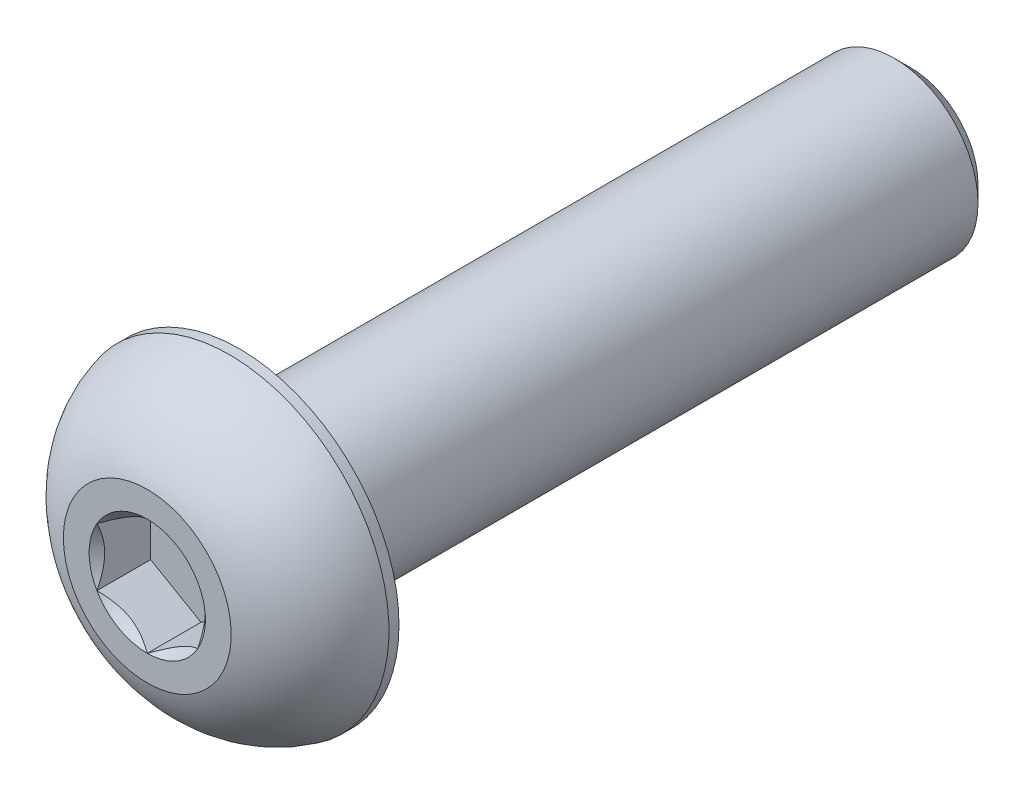
from build123d import *

# Parameters (mm, degrees)
BOSS_EXTRUDE1_START = -21.2
SKETCH1_R           = 2.5
BOSS_EXTRUDE1_DEPTH = 20
SKETCH2_R           = 4.75
BOSS_EXTRUDE2_DEPTH = 2.75
CUT_EXTRUDE1_DEPTH  = 1.6
SKETCH5_R           = 1.732050808
CUT_EXTRUDE2_DEPTH  = 1
CUT_EXTRUDE2_DRAFT  = -45
CHAMFER1_SIZE       = 0.5


with BuildPart() as part:
    # Sketch1 → Boss-Extrude1 (new body)
    with BuildSketch(Plane.XY.offset(BOSS_EXTRUDE1_START)):
        with Locations((-20, 0)):
            Circle(SKETCH1_R)
    extrude(amount=-BOSS_EXTRUDE1_DEPTH)

    # Sketch2 → Boss-Extrude2 (add)
    with BuildSketch(Plane.XY.offset(-21.2)):
        with Locations((-20, 0)):
            Circle(SKETCH2_R)
    extrude(amount=BOSS_EXTRUDE2_DEPTH)

    # Sketch3 → Cut-Revolve1 (revolve, cut)
    with BuildSketch(Plane(origin=(-20, 0, 0), x_dir=(0, 0, -1), z_dir=(1, 0, 0))):
        with BuildLine():
            Line((18.45, 2.5), (17.45, 2.5))
            Line((17.45, 2.5), (17.45, 5.8))
            Line((17.45, 5.8), (20.9, 5.8))
            Line((20.9, 5.8), (20.9, 4.75))
            ThreePointArc((20.9, 4.75), (19.381051818, 3.945076909), (18.45, 2.5))
        make_face()
    revolve(axis=Axis((-20, 0, -41.2), (0, 0, 1)), mode=Mode.SUBTRACT)

    # Sketch4 → Cut-Extrude1 (cut)
    with BuildSketch(Plane.XY.offset(-18.45)):
        Polygon((-20, 1.732050808), (-21.5, 0.866025404), (-21.5, -0.866025404), (-20, -1.732050808), (-18.5, -0.866025404), (-18.5, 0.866025404), align=None)
    extrude(amount=-CUT_EXTRUDE1_DEPTH, mode=Mode.SUBTRACT)


with BuildPart() as cut_extrude2_tool:
    # Sketch5 → Cut-Extrude2 (with draft: the straight prism first)
    with BuildSketch(Plane.XY.offset(-18.45)):
        with Locations((-20, 0)):
            Circle(SKETCH5_R)
    extrude(amount=-CUT_EXTRUDE2_DEPTH)
    # Cut-Extrude2: the draft: its side faces are tilted about the plane it starts from
    cut_extrude2_sides = [cut_extrude2_tool.faces().sort_by_distance(p)[0] for p in [
        (-21.732050808, 0, -18.95),
    ]]
    draft(cut_extrude2_sides, Plane.XY.offset(-18.45), CUT_EXTRUDE2_DRAFT)


with BuildPart() as part_1:
    add(part.part)

    # Cut-Extrude2: cut by cut_extrude2_tool
    add(cut_extrude2_tool.part, mode=Mode.SUBTRACT)

    # Chamfer1
    chamfer1_edges = [part_1.edges().sort_by_distance(p)[0] for p in [
        (-22.5, 0, -41.2),
    ]]
    chamfer(chamfer1_edges, length=CHAMFER1_SIZE)


solid = part_1.part
